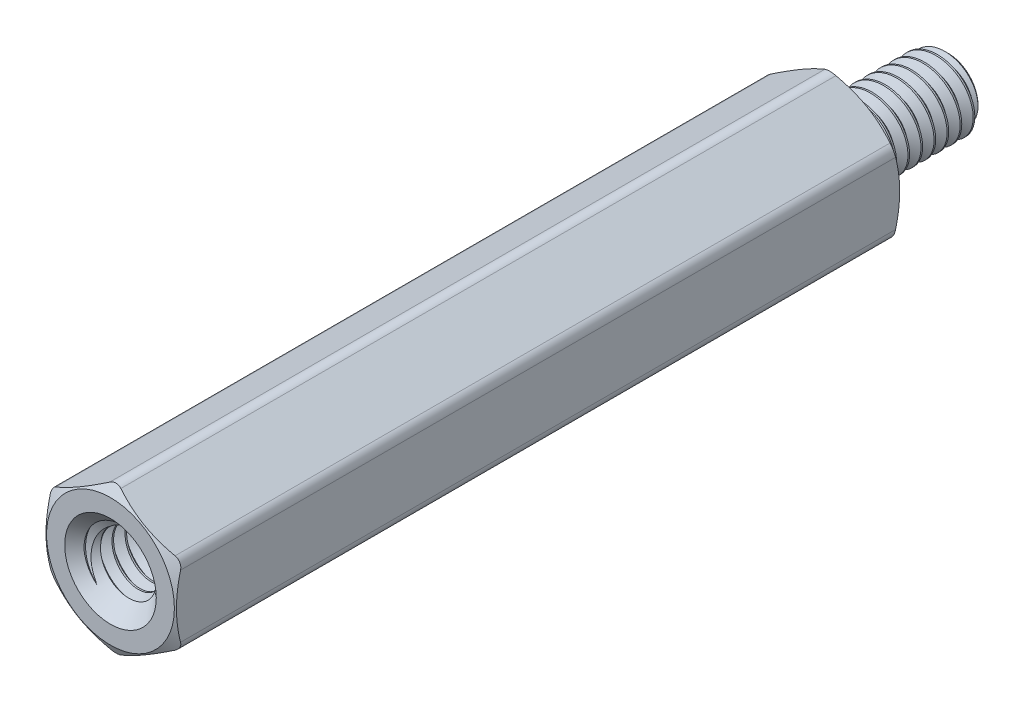
from build123d import *

# Parameters (mm, degrees)
SKETCH4_R           = 1.75
BOSS_EXTRUDE1_DEPTH = 25
SKETCH5_OUTSIDE_W   = 116.724
SKETCH5_OUTSIDE_H   = 117.42
SKETCH5_OUTSIDE_R   = 2.205
CUT_EXTRUDE1_DEPTH  = 30.103650974
CUT_EXTRUDE1_DRAFT  = -60
SKETCH6_OUTSIDE_W   = 103.322
SKETCH6_OUTSIDE_H   = 104.018
SKETCH6_OUTSIDE_R   = 2.205
CUT_EXTRUDE2_DEPTH  = 26.235144145
CUT_EXTRUDE2_DRAFT  = -60
FILLET1_R           = 0.3825
CUT_SWEEP1_PITCH    = 0.45
SKETCH9_R           = 1.475
BOSS_EXTRUDE2_DEPTH = 4.8
SKETCH10_W          = 4.8
SKETCH10_H          = 1.25
CUT_SWEEP2_PITCH    = 0.45


with BuildPart() as part:
    # Sketch3 → Revolve1 (revolve)
    with BuildSketch(Plane(origin=(0, 0, 0), x_dir=(0, 0, -1), z_dir=(1, 0, 0))):
        with BuildLine():
            Line((-20.2, 1.025), (-20.2, 0))
            Line((-20.2, 0), (3.9, 0))
            Line((3.9, 0), (3.9, 1.025))
            Line((3.9, 1.025), (3.675, 1.25))
            Line((3.675, 1.25), (0.63675, 1.25))
            Line((0.63675, 1.25), (0.468, 0.957716426))
            Line((0.468, 0.957716426), (0.225, 0.957716426))
            ThreePointArc((0.225, 0.957716426), (0.065900974, 1.0236174), (0, 1.182716426))
            Line((0, 1.182716426), (0, 2.25))
            Line((0, 2.25), (-25, 2.25))
            Line((-25, 2.25), (-25, 1.475))
            Line((-25, 1.475), (-24.775, 1.25))
            Line((-24.775, 1.25), (-20.425, 1.25))
            Line((-20.425, 1.25), (-20.2, 1.025))
        make_face()
    revolve(axis=Axis((0, 0, -3.9), (0, 0, 1)))

    # Sketch4 → Boss-Extrude1 (add)
    with BuildSketch(Plane.XY.offset(25)):
        Polygon((-2.25, 1.299038106), (-2.25, -1.299038106), (0, -2.598076211), (2.25, -1.299038106), (2.25, 1.299038106), (0, 2.598076211), align=None)
        Circle(SKETCH4_R, mode=Mode.SUBTRACT)
    extrude(amount=-BOSS_EXTRUDE1_DEPTH)


with BuildPart() as cut_extrude1_tool:
    # Sketch5 outside → Cut-Extrude1 (with draft: the straight prism first)
    with BuildSketch(Plane.XY.offset(25)):
        Rectangle(SKETCH5_OUTSIDE_W, SKETCH5_OUTSIDE_H)
        Circle(SKETCH5_OUTSIDE_R, mode=Mode.SUBTRACT)
    extrude(amount=-CUT_EXTRUDE1_DEPTH)
    # Cut-Extrude1: the draft: its side faces are tilted about the plane it starts from
    cut_extrude1_sides = [cut_extrude1_tool.faces().sort_by_distance(p)[0] for p in [
        (0, -58.71, 9.948174513),
        (58.362, 0, 9.948174513),
        (0, 58.71, 9.948174513),
        (-58.362, 0, 9.948174513),
        (-2.205, 0, 9.948174513),
    ]]
    draft(cut_extrude1_sides, Plane.XY.offset(25), CUT_EXTRUDE1_DRAFT)


with BuildPart() as part_1:
    add(part.part)

    # Cut-Extrude1: cut by cut_extrude1_tool
    add(cut_extrude1_tool.part, mode=Mode.SUBTRACT)


with BuildPart() as cut_extrude2_tool:
    # Sketch6 outside → Cut-Extrude2 (with draft: the straight prism first)
    with BuildSketch(Plane(origin=(0, 0, 0), x_dir=(-1, 0, 0), z_dir=(0, 0, -1))):
        Rectangle(SKETCH6_OUTSIDE_W, SKETCH6_OUTSIDE_H)
        Circle(SKETCH6_OUTSIDE_R, mode=Mode.SUBTRACT)
    extrude(amount=-CUT_EXTRUDE2_DEPTH)
    # Cut-Extrude2: the draft: its side faces are tilted about the plane it starts from
    cut_extrude2_sides = [cut_extrude2_tool.faces().sort_by_distance(p)[0] for p in [
        (0, -52.009, 13.117572072),
        (-51.661, 0, 13.117572072),
        (0, 52.009, 13.117572072),
        (51.661, 0, 13.117572072),
        (2.205, 0, 13.117572072),
    ]]
    draft(cut_extrude2_sides, Plane(origin=(0, 0, 0), x_dir=(-1, 0, 0), z_dir=(0, 0, -1)), CUT_EXTRUDE2_DRAFT)


with BuildPart() as part_2:
    add(part_1.part)

    # Cut-Extrude2: cut by cut_extrude2_tool
    add(cut_extrude2_tool.part, mode=Mode.SUBTRACT)

    # Fillet1
    fillet1_edges = [part_2.edges().sort_by_distance(p)[0] for p in [
        (0, 2.598076211, 12.5),
        (-2.25, -1.299038106, 12.5),
        (0, -2.598076211, 12.5),
        (2.25, -1.299038106, 12.5),
        (2.25, 1.299038106, 12.5),
        (-2.25, 1.299038106, 12.5),
    ]]
    fillet(fillet1_edges, radius=FILLET1_R)

    # Cut-Sweep1: the profile of Sketch7 profile screwed along a right-hand helix of 8.406667 turns, 6 arcs to a turn; built about Z, then put on its axis
    cut_sweep1_z = Axis((0, 0, 0), (0, 0, 1))
    cut_sweep1_corners = [(0.957416426, 0, -0.168923205), (0.957416426, 0, -0.224826795), (1.274356964, 0, -0.4078125), (1.274356964, 0, 0.0140625)]
    with BuildLine(mode=Mode.PRIVATE) as cut_sweep1_profile:
        Line(cut_sweep1_corners[0], cut_sweep1_corners[1])
        Line(cut_sweep1_corners[1], cut_sweep1_corners[2])
        Line(cut_sweep1_corners[2], cut_sweep1_corners[3])
        Line(cut_sweep1_corners[3], cut_sweep1_corners[0])
    cut_sweep1_cap = Face(cut_sweep1_profile.wire())
    cut_sweep1_turn_angles = [0, 30, 60, 90, 120, 150, 180, 210, 240, 270, 300, 330, 360]
    cut_sweep1_turn_weights = [1, 0.8660254037844387, 1, 0.8660254037844387, 1, 0.8660254037844387, 1, 0.8660254037844387, 1, 0.8660254037844387, 1, 0.8660254037844387, 1]
    cut_sweep1_turn_rails = [Edge.make_bspline([Vector(p[0], p[1], 0).rotate(cut_sweep1_z, cut_sweep1_turn_angles[k]) / cut_sweep1_turn_weights[k] + Vector(0, 0, p[2] + CUT_SWEEP1_PITCH * cut_sweep1_turn_angles[k] / 360) for k in range(13)], [0, 0, 0, 1, 1, 2, 2, 3, 3, 4, 4, 5, 5, 6, 6, 6], 2, cut_sweep1_turn_weights) for p in cut_sweep1_corners]
    cut_sweep1_turn_sides = [Face.make_surface_from_curves(cut_sweep1_turn_rails[p[0]], cut_sweep1_turn_rails[p[1]]) for p in [(0, 1), (1, 2), (2, 3), (3, 0)]]
    cut_sweep1_last_angles = [2880, 2910, 2940, 2970, 3000, 3013.2, 3026.4]
    cut_sweep1_last_weights = [1, 0.8660254037844387, 1, 0.8660254037844387, 1, 0.9735789028731574, 1]
    cut_sweep1_last_rails = [Edge.make_bspline([Vector(p[0], p[1], 0).rotate(cut_sweep1_z, cut_sweep1_last_angles[k]) / cut_sweep1_last_weights[k] + Vector(0, 0, p[2] + CUT_SWEEP1_PITCH * cut_sweep1_last_angles[k] / 360) for k in range(7)], [0, 0, 0, 1, 1, 2, 2, 3, 3, 3], 2, cut_sweep1_last_weights) for p in cut_sweep1_corners]
    cut_sweep1_last_sides = [Face.make_surface_from_curves(cut_sweep1_last_rails[p[0]], cut_sweep1_last_rails[p[1]]) for p in [(0, 1), (1, 2), (2, 3), (3, 0)]]
    cut_sweep1 = Plane(origin=(0, 0, -3.9), x_dir=(0, 1, 0), z_dir=(0, 0, 1)) * Solid(Shell([*[p.moved(Location((0, 0, CUT_SWEEP1_PITCH * i))) for i in range(8) for p in cut_sweep1_turn_sides], *cut_sweep1_last_sides, cut_sweep1_cap, cut_sweep1_cap.rotate(cut_sweep1_z, 3026.4).moved(Location((0, 0, CUT_SWEEP1_PITCH * 3026.4 / 360)))]))
    add(cut_sweep1, mode=Mode.SUBTRACT)

    # Sketch9 → Boss-Extrude2 (add)
    with BuildSketch(Plane.XY.offset(20.2)):
        Circle(SKETCH9_R)
    extrude(amount=BOSS_EXTRUDE2_DEPTH)


with BuildPart() as body_2:
    # Sketch10 → Revolve2 (revolve)
    with BuildSketch(Plane(origin=(0, 0, 0), x_dir=(0, 0, -1), z_dir=(1, 0, 0))):
        with Locations((-22.6, 0.625)):
            Rectangle(SKETCH10_W, SKETCH10_H)
    revolve(axis=Axis((0, 0, -3.9), (0, 0, 1)))

    # Cut-Sweep2: the profile of Sketch12 profile screwed along a right-hand helix of 11.666667 turns, 6 arcs to a turn; built about Z, then put on its axis
    cut_sweep2_z = Axis((0, 0, 0), (0, 0, 1))
    cut_sweep2_corners = [(0.957416426, 0, -0.224826795), (0.957416426, 0, -0.168923205), (1.274356964, 0, 0.0140625), (1.274356964, 0, -0.4078125)]
    with BuildLine(mode=Mode.PRIVATE) as cut_sweep2_profile:
        Line(cut_sweep2_corners[0], cut_sweep2_corners[1])
        Line(cut_sweep2_corners[1], cut_sweep2_corners[2])
        Line(cut_sweep2_corners[2], cut_sweep2_corners[3])
        Line(cut_sweep2_corners[3], cut_sweep2_corners[0])
    cut_sweep2_cap = Face(cut_sweep2_profile.wire())
    cut_sweep2_turn_angles = [0, 30, 60, 90, 120, 150, 180, 210, 240, 270, 300, 330, 360]
    cut_sweep2_turn_weights = [1, 0.8660254037844387, 1, 0.8660254037844387, 1, 0.8660254037844387, 1, 0.8660254037844387, 1, 0.8660254037844387, 1, 0.8660254037844387, 1]
    cut_sweep2_turn_rails = [Edge.make_bspline([Vector(p[0], p[1], 0).rotate(cut_sweep2_z, cut_sweep2_turn_angles[k]) / cut_sweep2_turn_weights[k] + Vector(0, 0, p[2] + CUT_SWEEP2_PITCH * cut_sweep2_turn_angles[k] / 360) for k in range(13)], [0, 0, 0, 1, 1, 2, 2, 3, 3, 4, 4, 5, 5, 6, 6, 6], 2, cut_sweep2_turn_weights) for p in cut_sweep2_corners]
    cut_sweep2_turn_sides = [Face.make_surface_from_curves(cut_sweep2_turn_rails[p[0]], cut_sweep2_turn_rails[p[1]]) for p in [(0, 1), (1, 2), (2, 3), (3, 0)]]
    cut_sweep2_last_angles = [3960, 3990, 4020, 4050, 4080, 4110, 4140, 4170, 4200]
    cut_sweep2_last_weights = [1, 0.8660254037844387, 1, 0.8660254037844387, 1, 0.8660254037844387, 1, 0.8660254037842601, 1]
    cut_sweep2_last_rails = [Edge.make_bspline([Vector(p[0], p[1], 0).rotate(cut_sweep2_z, cut_sweep2_last_angles[k]) / cut_sweep2_last_weights[k] + Vector(0, 0, p[2] + CUT_SWEEP2_PITCH * cut_sweep2_last_angles[k] / 360) for k in range(9)], [0, 0, 0, 1, 1, 2, 2, 3, 3, 4, 4, 4], 2, cut_sweep2_last_weights) for p in cut_sweep2_corners]
    cut_sweep2_last_sides = [Face.make_surface_from_curves(cut_sweep2_last_rails[p[0]], cut_sweep2_last_rails[p[1]]) for p in [(0, 1), (1, 2), (2, 3), (3, 0)]]
    cut_sweep2 = Plane(origin=(0, 0, 25), x_dir=(0, 1, 0), z_dir=(0, 0, -1)) * Solid(Shell([*[p.moved(Location((0, 0, CUT_SWEEP2_PITCH * i))) for i in range(11) for p in cut_sweep2_turn_sides], *cut_sweep2_last_sides, cut_sweep2_cap, cut_sweep2_cap.rotate(cut_sweep2_z, 4200).moved(Location((0, 0, CUT_SWEEP2_PITCH * 4200 / 360)))]))
    add(cut_sweep2, mode=Mode.SUBTRACT)


with BuildPart() as part_3:
    add(part_2.part)

    # Combine1: cut body 2
    add(body_2.part, mode=Mode.SUBTRACT)

    # Cut-Extrude3 cone 1 section (through the dimple's axis) → Cut-Extrude3 (revolve, cut)
    with BuildSketch(Plane(origin=(0, 0, 25), x_dir=(0, -1, 0), z_dir=(1, 0, 0))):
        Polygon((0, 0), (1.58, 0), (0, 1.58), align=None)
    revolve(axis=Axis((0, 0, 25), (0, 0, -1)), mode=Mode.SUBTRACT)


solid = part_3.part
